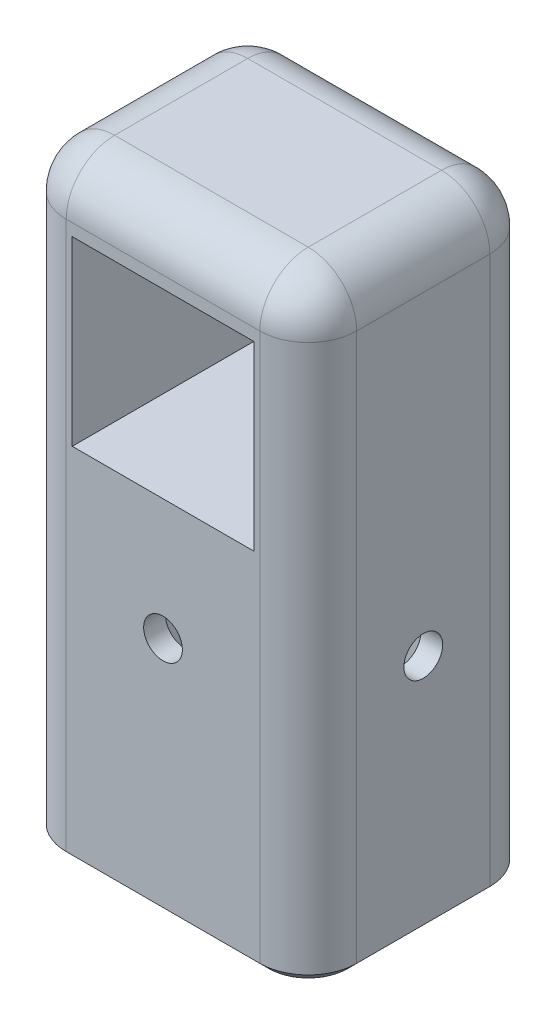
from build123d import *

# Parameters (mm, degrees)
SKETCH1_W           = 24
SKETCH1_H           = 19
BOSS_EXTRUDE1_DEPTH = 50
SKETCH2_W           = 15
SKETCH2_H           = 15
CUT_EXTRUDE1_DEPTH  = 16
CUT_EXTRUDE2_REACH  = 59.723
SKETCH3_R           = 1.6
SKETCH4_W           = 5.9
SKETCH4_H           = 3
SKETCH4_W_2         = 3
SKETCH4_H_2         = 5.9
CUT_EXTRUDE3_DEPTH  = 23
SKETCH5_R           = 1.6
CUT_EXTRUDE4_DEPTH  = 59.625932828
SKETCH6_R           = 1.6
CUT_EXTRUDE5_DEPTH  = 59.625932828
FILLET4_R           = 4
FILLET5_R           = 4
CHAMFER1_SIZE       = 0.75


with BuildPart() as part:
    # Sketch1 → Boss-Extrude1 (new body)
    with BuildSketch(Plane(origin=(0, 0, 0), x_dir=(1, 0, 0), z_dir=(0, 1, 0))):
        with Locations((12, 9.5)):
            Rectangle(SKETCH1_W, SKETCH1_H)
    extrude(amount=BOSS_EXTRUDE1_DEPTH)

    # Sketch2 → Cut-Extrude1 (cut)
    with BuildSketch(Plane.XY):
        with Locations((12, 37.5)):
            Rectangle(SKETCH2_W, SKETCH2_H)
    extrude(amount=-CUT_EXTRUDE1_DEPTH, mode=Mode.SUBTRACT)

    # Sketch3 → Cut-Extrude2 (cut, up to next)
    with BuildSketch(Plane.XY.offset(-16), mode=Mode.PRIVATE) as cut_extrude2_sk1:
        with Locations((12, 37.5)):
            Circle(SKETCH3_R)
    cut_extrude2_tool1 = extrude(cut_extrude2_sk1.sketch, amount=-CUT_EXTRUDE2_REACH, mode=Mode.PRIVATE) & part.part
    add(cut_extrude2_tool1.solids().sort_by_distance((12, 37.5, -16))[0], mode=Mode.SUBTRACT)

    # Sketch4 → Cut-Extrude3 (cut)
    with BuildSketch(Plane.XZ):
        with Locations((12, -15.7)):
            Rectangle(SKETCH4_W, SKETCH4_H)
        with Locations((3.3, -9.5)):
            Rectangle(SKETCH4_W_2, SKETCH4_H_2)
        with Locations((12, -3.3)):
            Rectangle(SKETCH4_W, SKETCH4_H)
        with Locations((20.7, -9.5)):
            Rectangle(SKETCH4_W_2, SKETCH4_H_2)
    extrude(amount=-CUT_EXTRUDE3_DEPTH, mode=Mode.SUBTRACT)

    # Sketch5 → Cut-Extrude4 (cut, through all)
    with BuildSketch(Plane(origin=(0, 0, -19), x_dir=(-1, 0, 0), z_dir=(0, 0, -1))):
        with Locations((-12, 20)):
            Circle(SKETCH5_R)
    extrude(amount=-CUT_EXTRUDE4_DEPTH, mode=Mode.SUBTRACT)

    # Sketch6 → Cut-Extrude5 (cut, through all)
    with BuildSketch(Plane.ZY):
        with Locations((-9.5, 20)):
            Circle(SKETCH6_R)
    extrude(amount=-CUT_EXTRUDE5_DEPTH, mode=Mode.SUBTRACT)

    # Fillet4
    fillet4_edges = [part.edges().sort_by_distance(p)[0] for p in [
        (24, 25, -19),
        (0, 25, -19),
        (24, 25, 0),
        (0, 25, 0),
    ]]
    fillet(fillet4_edges, radius=FILLET4_R)

    # Fillet5
    fillet5_edges = [part.edges().sort_by_distance(p)[0] for p in [
        (12, 50, 0),
        (22.828427125, 50, -1.171572875),
        (24, 50, -9.5),
        (22.828427125, 50, -17.828427125),
        (12, 50, -19),
        (1.171572875, 50, -17.828427125),
        (1.171572875, 50, -1.171572875),
        (0, 50, -9.5),
    ]]
    fillet(fillet5_edges, radius=FILLET5_R)

    # Chamfer1
    chamfer1_edges = [part.edges().sort_by_distance(p)[0] for p in [
        (12, 0, 0),
        (22.828427125, 0, -1.171572875),
        (1.171572875, 0, -1.171572875),
        (24, 0, -9.5),
        (0, 0, -9.5),
        (22.828427125, 0, -17.828427125),
        (1.171572875, 0, -17.828427125),
        (12, 0, -19),
        (20.7, 0, -12.45),
        (22.2, 0, -9.5),
        (20.7, 0, -6.55),
        (19.2, 0, -9.5),
        (12, 0, -4.8),
        (14.95, 0, -3.3),
        (12, 0, -1.8),
        (9.05, 0, -3.3),
        (3.3, 0, -12.45),
        (4.8, 0, -9.5),
        (3.3, 0, -6.55),
        (1.8, 0, -9.5),
        (12, 0, -17.2),
        (14.95, 0, -15.7),
        (12, 0, -14.2),
        (9.05, 0, -15.7),
    ]]
    chamfer(chamfer1_edges, length=CHAMFER1_SIZE)


solid = part.part
